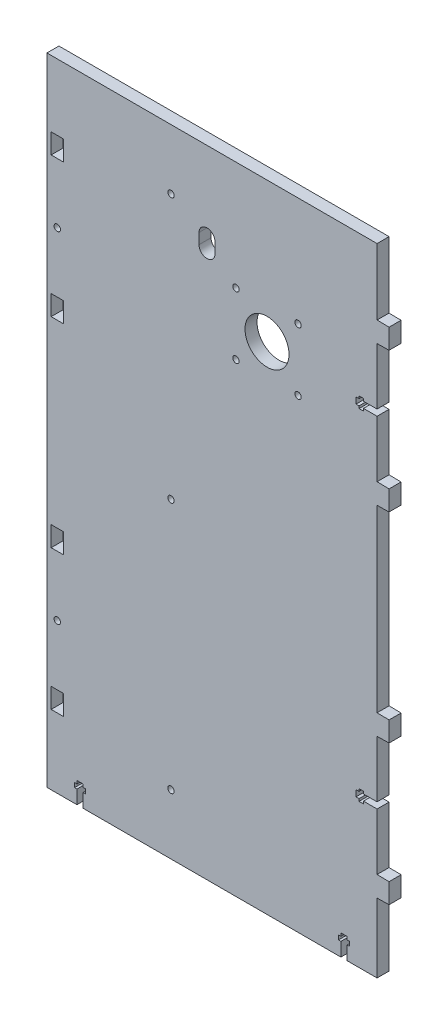
from build123d import *

# Parameters (mm, degrees)
SKETCH_1_R      = 1.6
SKETCH_1_R_2    = 11
SKETCH_1_W      = 6.1
SKETCH_1_H      = 10
EXTRUDE_1_DEPTH = 6


with BuildPart() as part:
    # Эскиз1 → Бобышка-Вытянуть1 (new body)
    with BuildSketch(Plane.XY):
        Polygon((1079.111005263, 623.038519), (1085.111005263, 623.138519), (1085.111005263, 633.138519), (1079.111005263, 633.238519), (1079.111005263, 723.038519), (1085.111005263, 723.138519), (1085.111005263, 733.138519), (1079.111005263, 733.238519), (1079.111005263, 761.588519), (1072.311005263, 761.588519), (1072.311005263, 760.388519), (1070.111005263, 760.388519), (1070.111005263, 761.588519), (1068.611005263, 761.588519), (1068.611005263, 764.688519), (1070.111005263, 764.688519), (1070.111005263, 765.888519), (1072.311005263, 765.888519), (1072.311005263, 764.688519), (1079.111005263, 764.688519), (1079.111005263, 793.038519), (1085.111005263, 793.138519), (1085.111005263, 803.138519), (1079.111005263, 803.238519), (1079.111005263, 836.338519), (979.111005263, 836.338519), (914.111005263, 836.338519), (914.111005263, 518.436195), (929.111005263, 518.436195), (929.111005263, 525.236195), (927.911005263, 525.236195), (927.911005263, 527.436195), (929.111005263, 527.436195), (929.111005263, 528.936195), (932.211005263, 528.936195), (932.211005263, 527.436195), (933.411005263, 527.436195), (933.411005263, 525.236195), (932.211005263, 525.236195), (932.211005263, 518.436195), (979.111005263, 518.436195), (1061.011005263, 518.436195), (1061.011005263, 525.236195), (1059.811005263, 525.236195), (1059.811005263, 527.436195), (1061.011005263, 527.436195), (1061.011005263, 528.936195), (1064.111005263, 528.936195), (1064.111005263, 527.436195), (1065.311005263, 527.436195), (1065.311005263, 525.236195), (1064.111005263, 525.236195), (1064.111005263, 518.436195), (1079.111005263, 518.436195), (1079.111005263, 553.038519), (1085.111005263, 553.138519), (1085.111005263, 563.138519), (1079.111005263, 563.238519), (1079.111005263, 591.588519), (1072.311005263, 591.588519), (1072.311005263, 590.388519), (1070.111005263, 590.388519), (1070.111005263, 591.588519), (1068.611005263, 591.588519), (1068.611005263, 594.688519), (1070.111005263, 594.688519), (1070.111005263, 595.888519), (1072.311005263, 595.888519), (1072.311005263, 594.688519), (1079.111005263, 594.688519), align=None)
        with Locations((919.269864828, 593.238519)):
            Circle(SKETCH_1_R, mode=Mode.SUBTRACT)
        with Locations((919.269864828, 763.238519)):
            Circle(SKETCH_1_R, mode=Mode.SUBTRACT)
        with Locations((976.111005263, 806.338519)):
            Circle(SKETCH_1_R, mode=Mode.SUBTRACT)
        with Locations((976.111005263, 674.138519)):
            Circle(SKETCH_1_R, mode=Mode.SUBTRACT)
        with Locations((976.111005263, 548.438519)):
            Circle(SKETCH_1_R, mode=Mode.SUBTRACT)
        with Locations((1008.611005263, 781.838519)):
            Circle(SKETCH_1_R, mode=Mode.SUBTRACT)
        with Locations((1008.611005263, 750.838519)):
            Circle(SKETCH_1_R, mode=Mode.SUBTRACT)
        with Locations((1024.111005263, 766.338519)):
            Circle(SKETCH_1_R_2, mode=Mode.SUBTRACT)
        with Locations((1039.611005263, 750.838519)):
            Circle(SKETCH_1_R, mode=Mode.SUBTRACT)
        with Locations((1039.611005263, 781.838519)):
            Circle(SKETCH_1_R, mode=Mode.SUBTRACT)
        with BuildLine():
            Line((998.111005263, 791.338519), (998.111005263, 796.621459479))
            ThreePointArc((998.111005263, 796.621459479), (994.111005263, 800.621459479), (990.111005263, 796.621459479))
            Line((990.111005263, 796.621459479), (990.111005263, 791.338519))
            ThreePointArc((990.111005263, 791.338519), (994.111005263, 787.338519), (998.111005263, 791.338519))
        make_face(mode=Mode.SUBTRACT)
        with Locations((919.269864828, 558.238519)):
            Rectangle(SKETCH_1_W, SKETCH_1_H, mode=Mode.SUBTRACT)
        with Locations((919.269864828, 628.238519)):
            Rectangle(SKETCH_1_W, SKETCH_1_H, mode=Mode.SUBTRACT)
        with Locations((919.269864828, 728.238519)):
            Rectangle(SKETCH_1_W, SKETCH_1_H, mode=Mode.SUBTRACT)
        with Locations((919.269864828, 798.238519)):
            Rectangle(SKETCH_1_W, SKETCH_1_H, mode=Mode.SUBTRACT)
    extrude(amount=EXTRUDE_1_DEPTH)


solid = part.part
